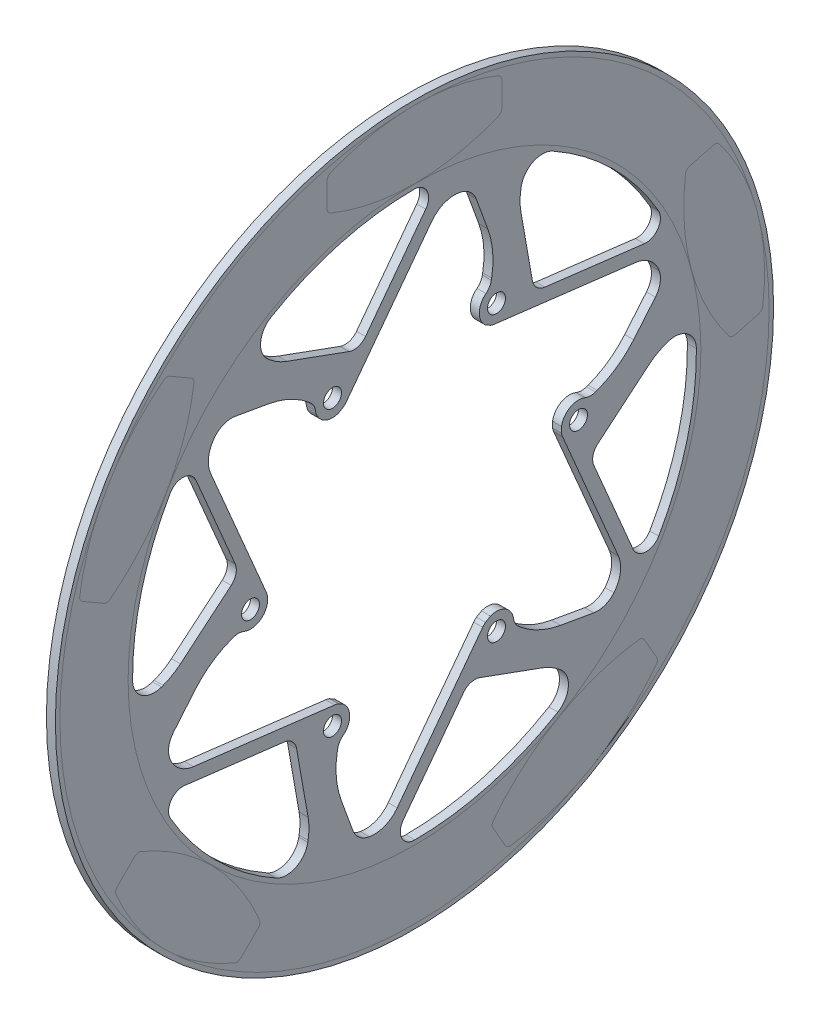
from build123d import *

# Parameters (mm, degrees)
SKETCH1_R           = 127
SKETCH1_R_2         = 3.175
SKETCH1_R_3         = 52
BOSS_EXTRUDE1_DEPTH = 3.175
CUT_EXTRUDE9_DEPTH  = 180.63318353
CIRPATTERN1_COUNT   = 6


with BuildPart() as part:
    # Sketch1 → Boss-Extrude1 (new body)
    with BuildSketch(Plane(origin=(0, 0, 0), x_dir=(0, 0, -1), z_dir=(1, 0, 0))):
        Circle(SKETCH1_R)
        with Locations((-29, -50.229473419)):
            Circle(SKETCH1_R_2, mode=Mode.SUBTRACT)
        with Locations((29, -50.229473419)):
            Circle(SKETCH1_R_2, mode=Mode.SUBTRACT)
        with Locations((-58, 0)):
            Circle(SKETCH1_R_2, mode=Mode.SUBTRACT)
        with Locations((-29, 50.229473419)):
            Circle(SKETCH1_R_2, mode=Mode.SUBTRACT)
        Circle(SKETCH1_R_3, mode=Mode.SUBTRACT)
        with Locations((58, 0)):
            Circle(SKETCH1_R_2, mode=Mode.SUBTRACT)
        with Locations((29, 50.229473419)):
            Circle(SKETCH1_R_2, mode=Mode.SUBTRACT)
    extrude(amount=BOSS_EXTRUDE1_DEPTH)

    # Sketch32 → Cut-Extrude9 (cut, through all)
    with BuildSketch(Plane(origin=(3.175, 0, 0), x_dir=(0, 0, -1), z_dir=(1, 0, 0))):
        with BuildLine():
            ThreePointArc((37.632321823, 80.901706953), (37.323615365, 77.373175983), (37.632321823, 73.844645013))
            Line((37.632321823, 73.844645013), (41.7, 50.775695721))
            ThreePointArc((41.7, 50.775695721), (43.208009485, 47.97100384), (46.089274169, 46.615016018))
            Line((46.089274169, 46.615016018), (81.28615115, 42.332680217))
            ThreePointArc((81.28615115, 42.332680217), (86.138544158, 44.575742085), (86.296999714, 49.919143276))
            ThreePointArc((86.296999714, 49.919143276), (70.115287281, 70.87269936), (48.989083661, 86.828351977))
            ThreePointArc((48.989083661, 86.828351977), (41.990149422, 87.08180691), (37.740460023, 81.514989157))
            Line((37.740460023, 81.514989157), (37.632321823, 80.901706953))
        make_face()
        with BuildLine():
            Line((78.202019463, 38.102204931), (28.263740941, 44.178098485))
            ThreePointArc((28.263740941, 44.178098485), (23.121160069, 48.616880145), (25.279258418, 55.058272243))
            ThreePointArc((25.279258418, 55.058272243), (26.524244124, 56.451277428), (27.181463819, 58.200138521))
            Line((27.181463819, 58.200138521), (27.291248926, 58.822760801))
            ThreePointArc((27.291248926, 58.822760801), (27.638323012, 66.772064295), (25.916139695, 74.540331225))
            Line((25.916139695, 74.540331225), (21.825914615, 85.778132273))
            ThreePointArc((21.825914615, 85.778132273), (19.563498431, 89.009197437), (15.988655959, 90.676173859))
            Line((15.988655959, 90.676173859), (0, 0))
            Line((0, 0), (86.522198059, 31.491504697))
            ThreePointArc((86.522198059, 31.491504697), (83.295295311, 35.971356528), (78.202019463, 38.102204931))
        make_face()
    cut_extrude9 = extrude(amount=-CUT_EXTRUDE9_DEPTH, mode=Mode.SUBTRACT)

    # CirPattern1: Cut-Extrude9 ×6 about axis
    cirpattern1_axis = Axis((3.175, 0, 0), (-1, 0, 0))
    for i in range(1, CIRPATTERN1_COUNT):
        add(cut_extrude9.rotate(cirpattern1_axis, i * 360 / CIRPATTERN1_COUNT), mode=Mode.SUBTRACT)


solid = part.part
